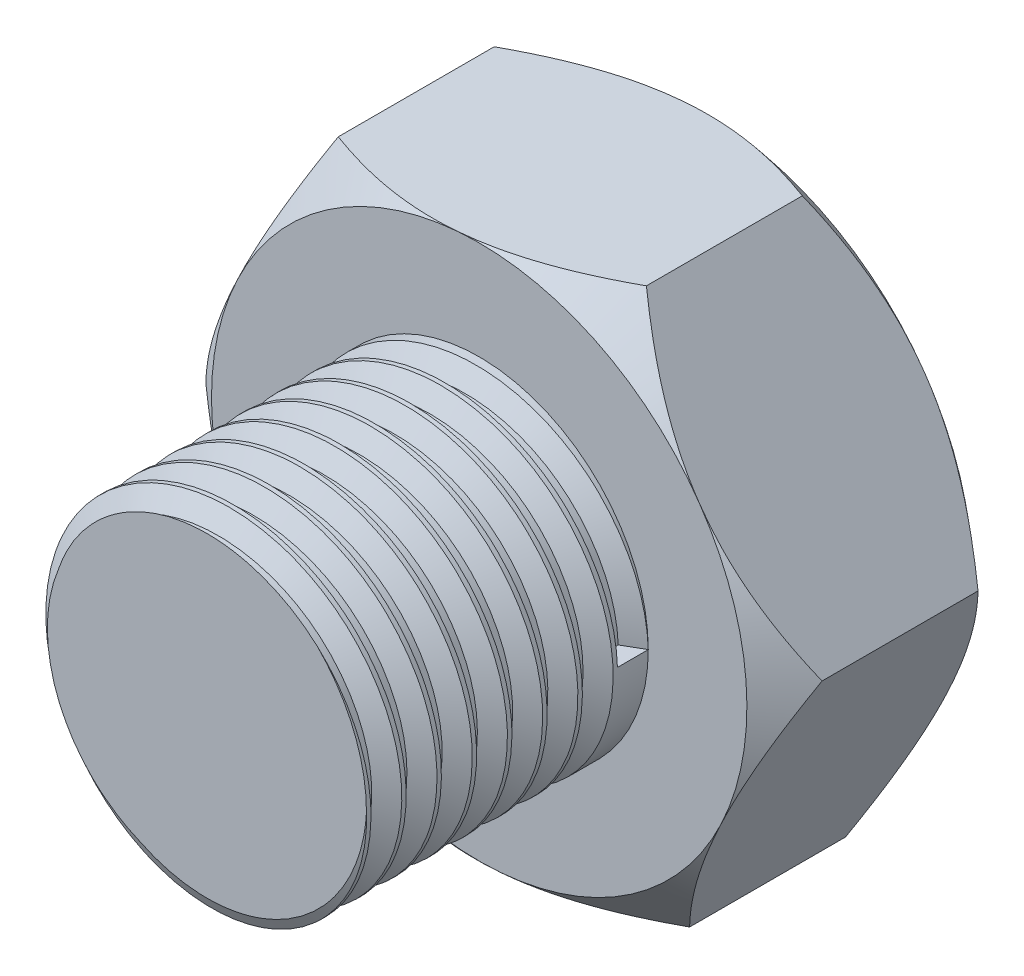
from build123d import *

# Parameters (mm, degrees)
SKETCH1_R           = 6
BOSS_EXTRUDE1_DEPTH = 10
BOSS_EXTRUDE2_DEPTH = 8
SKETCH3_OUTSIDE_W   = 49.85
SKETCH3_OUTSIDE_H   = 47.806
SKETCH3_OUTSIDE_R   = 9.5
CUT_EXTRUDE1_DEPTH  = 8
CUT_EXTRUDE1_DRAFT  = -50
SKETCH4_OUTSIDE_W   = 49.85
SKETCH4_OUTSIDE_H   = 47.806
SKETCH4_OUTSIDE_R   = 9.5
CUT_EXTRUDE3_DEPTH  = 8
CUT_EXTRUDE3_DRAFT  = -50
THREAD1_PITCH       = 1.25


with BuildPart() as part:
    # Sketch1 → Boss-Extrude1 (new body)
    with BuildSketch(Plane.XY):
        Circle(SKETCH1_R)
    extrude(amount=BOSS_EXTRUDE1_DEPTH)

    # Sketch2 → Boss-Extrude2 (add)
    with BuildSketch(Plane(origin=(0, 0, 0), x_dir=(-1, 0, 0), z_dir=(0, 0, -1))):
        Polygon((-10.93381737, 0.885985919), (-6.234194998, -9.025970644), (4.699622372, -9.911956562), (10.93381737, -0.885985919), (6.234194998, 9.025970644), (-4.699622372, 9.911956562), align=None)
    extrude(amount=BOSS_EXTRUDE2_DEPTH)


with BuildPart() as cut_extrude1_tool:
    # Sketch3 outside → Cut-Extrude1 (with draft: the straight prism first)
    with BuildSketch(Plane.XY):
        Rectangle(SKETCH3_OUTSIDE_W, SKETCH3_OUTSIDE_H)
        Circle(SKETCH3_OUTSIDE_R, mode=Mode.SUBTRACT)
    extrude(amount=-CUT_EXTRUDE1_DEPTH)
    # Cut-Extrude1: the draft: its side faces are tilted about the plane it starts from
    cut_extrude1_sides = [cut_extrude1_tool.faces().sort_by_distance(p)[0] for p in [
        (0, -23.903, -4),
        (24.925, 0, -4),
        (0, 23.903, -4),
        (-24.925, 0, -4),
        (-9.5, 0, -4),
    ]]
    draft(cut_extrude1_sides, Plane.XY, CUT_EXTRUDE1_DRAFT)


with BuildPart() as part_1:
    add(part.part)

    # Cut-Extrude1: cut by cut_extrude1_tool
    add(cut_extrude1_tool.part, mode=Mode.SUBTRACT)


with BuildPart() as cut_extrude3_tool:
    # Sketch4 outside → Cut-Extrude3 (with draft: the straight prism first)
    with BuildSketch(Plane(origin=(0, 0, -8), x_dir=(-1, 0, 0), z_dir=(0, 0, -1))):
        Rectangle(SKETCH4_OUTSIDE_W, SKETCH4_OUTSIDE_H)
        Circle(SKETCH4_OUTSIDE_R, mode=Mode.SUBTRACT)
    extrude(amount=-CUT_EXTRUDE3_DEPTH)
    # Cut-Extrude3: the draft: its side faces are tilted about the plane it starts from
    cut_extrude3_sides = [cut_extrude3_tool.faces().sort_by_distance(p)[0] for p in [
        (0, -23.903, -4),
        (-24.925, 0, -4),
        (0, 23.903, -4),
        (24.925, 0, -4),
        (9.5, 0, -4),
    ]]
    draft(cut_extrude3_sides, Plane(origin=(0, 0, -8), x_dir=(-1, 0, 0), z_dir=(0, 0, -1)), CUT_EXTRUDE3_DRAFT)


with BuildPart() as part_2:
    add(part_1.part)

    # Cut-Extrude3: cut by cut_extrude3_tool
    add(cut_extrude3_tool.part, mode=Mode.SUBTRACT)

    # Thread1: the profile of Thread Profile2 profile screwed along a right-hand helix of 16 turns, 8 arcs to a turn; built about Z, then put on its axis
    thread1_z = Axis((0, 0, 0), (0, 0, 1))
    thread1_corners = [(6.0003, 0, -0.000173205), (6.0003, 0, 1.093923202), (5.323417656, 0, 0.703124998), (5.323417656, 0, 0.390624998)]
    with BuildLine(mode=Mode.PRIVATE) as thread1_profile:
        Line(thread1_corners[0], thread1_corners[1])
        Line(thread1_corners[1], thread1_corners[2])
        Line(thread1_corners[2], thread1_corners[3])
        Line(thread1_corners[3], thread1_corners[0])
    thread1_cap = Face(thread1_profile.wire())
    thread1_turn_angles = [0, 22.5, 45, 67.5, 90, 112.5, 135, 157.5, 180, 202.5, 225, 247.5, 270, 292.5, 315, 337.5, 360]
    thread1_turn_weights = [1, 0.9238795325112867, 1, 0.9238795325112867, 1, 0.9238795325112867, 1, 0.9238795325112867, 1, 0.9238795325112867, 1, 0.9238795325112867, 1, 0.9238795325112867, 1, 0.9238795325112867, 1]
    thread1_turn_rails = [Edge.make_bspline([Vector(p[0], p[1], 0).rotate(thread1_z, thread1_turn_angles[k]) / thread1_turn_weights[k] + Vector(0, 0, p[2] + THREAD1_PITCH * thread1_turn_angles[k] / 360) for k in range(17)], [0, 0, 0, 1, 1, 2, 2, 3, 3, 4, 4, 5, 5, 6, 6, 7, 7, 8, 8, 8], 2, thread1_turn_weights) for p in thread1_corners]
    thread1_turn_sides = [Face.make_surface_from_curves(thread1_turn_rails[p[0]], thread1_turn_rails[p[1]]) for p in [(0, 1), (1, 2), (2, 3), (3, 0)]]
    thread1 = Plane(origin=(0, 0, 0), x_dir=(1, 0, 0), z_dir=(0, 0, 1)) * Solid(Shell([*[p.moved(Location((0, 0, THREAD1_PITCH * i))) for i in range(16) for p in thread1_turn_sides], thread1_cap, thread1_cap.rotate(thread1_z, 5760).moved(Location((0, 0, THREAD1_PITCH * 5760 / 360)))]))
    add(thread1, mode=Mode.SUBTRACT)


solid = part_2.part
